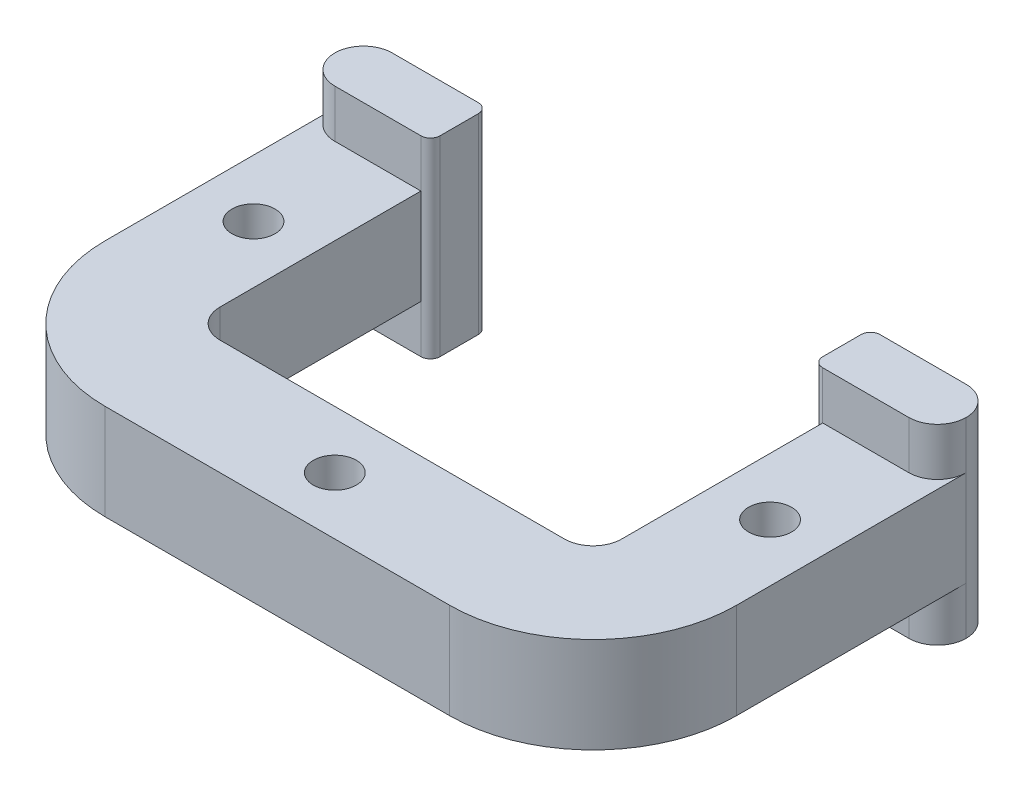
from build123d import *

# Parameters (mm, degrees)
BOSS_EXTRUDE1_DEPTH = 20
SKETCH2_R           = 2.75
CUT_EXTRUDE1_DEPTH  = 5
FILLET1_R           = 1
SKETCH7_W           = 42
SKETCH7_H           = 12
CUT_EXTRUDE3_DEPTH  = 5
SKETCH9_R           = 2.25
CUT_EXTRUDE5_DEPTH  = 56.479726027
FILLET3_R           = 15
FILLET4_R           = 3
FILLET5_R           = 3


# Some blends are built 0.0001 mm under size
with BuildPart() as part:
    # Sketch1 → Boss-Extrude1 (new body)
    with BuildSketch(Plane(origin=(0, 0, 0), x_dir=(1, 0, 0), z_dir=(0, 1, 0))):
        Polygon((21, -30), (-21, -30), (-21, -6), (-20, -6), (-20, 0), (-33, 0), (-33, -42), (33, -42), (33, 0), (20, 0), (20, -6), (21, -6), align=None)
    extrude(amount=BOSS_EXTRUDE1_DEPTH)

    # Sketch2 → Cut-Extrude1 (cut)
    with BuildSketch(Plane(origin=(0, 0, 0), x_dir=(-1, 0, 0), z_dir=(0, 0, -1))):
        with Locations((-24.25, 14.79)):
            Circle(SKETCH2_R)
        with Locations((-24.25, 4.79)):
            Circle(SKETCH2_R)
    cut_extrude1 = extrude(amount=-CUT_EXTRUDE1_DEPTH, mode=Mode.SUBTRACT)

    # Mirror1: Cut-Extrude1 across plane
    add(cut_extrude1.mirror(Plane(origin=(0, 0, 0), x_dir=(0, 0, 1), z_dir=(1, 0, 0))), mode=Mode.SUBTRACT)

    # Fillet1
    fillet1_edges = [part.edges().sort_by_distance(p)[0] for p in [
        (-20, 10, 0),
        (20, 10, 0),
        (20, 10, 6),
        (-20, 10, 6),
    ]]
    fillet(fillet1_edges, radius=FILLET1_R - 0.0001)  # a hair under: the kernel refuses the full size

    # Sketch7 → Cut-Extrude3 (cut)
    with BuildSketch(Plane.XZ):
        Polygon((-33, 6), (-21, 6), (-21, 30), (-21, 42), (-33, 42), align=None)
        with Locations((0, 36)):
            Rectangle(SKETCH7_W, SKETCH7_H)
        Polygon((21, 42), (21, 30), (21, 6), (33, 6), (33, 42), align=None)
    cut_extrude3 = extrude(amount=-CUT_EXTRUDE3_DEPTH, mode=Mode.SUBTRACT)

    # Mirror2: Cut-Extrude3 across plane
    add(cut_extrude3.mirror(Plane.ZX.offset(10)), mode=Mode.SUBTRACT)

    # Sketch9 → Cut-Extrude5 (cut, through all)
    with BuildSketch(Plane.XZ.offset(-5)):
        with Locations(Location((-27, 17.5, 0), (0, 0, 270))):
            Circle(SKETCH9_R)
        with Locations(Location((27, 17.5, 0), (0, 0, 270))):
            Circle(SKETCH9_R)
        with Locations(Location((0, 36, 0), (0, 0, 270))):
            Circle(SKETCH9_R)
    extrude(amount=-CUT_EXTRUDE5_DEPTH, mode=Mode.SUBTRACT)

    # Fillet3
    fillet3_edges = [part.edges().sort_by_distance(p)[0] for p in [
        (-33, 10, 42),
        (33, 10, 42),
    ]]
    fillet(fillet3_edges, radius=FILLET3_R)

    # Fillet4
    fillet4_edges = [part.edges().sort_by_distance(p)[0] for p in [
        (-21, 10, 30),
        (21, 10, 30),
    ]]
    fillet(fillet4_edges, radius=FILLET4_R)

    # Fillet5
    # the kernel refuses this fillet: 3 mm, written as the material it takes off along each edge
    with BuildSketch(Plane(origin=(-33, 27.5, 6), x_dir=(1, 0, 0), z_dir=(0, -1, 0)), Plane(origin=(33, -7.5, 6), x_dir=(-1, 0, 0), z_dir=(0, 1, 0))) as fillet5_piece_1:
        with BuildLine():
            CenterArc((FILLET5_R, -FILLET5_R), FILLET5_R, 90, 90)
            Line((0, -FILLET5_R), (0, 0))
            Line((0, 0), (FILLET5_R, 0))
        make_face()
    extrude(amount=12.5, mode=Mode.SUBTRACT)
    with BuildSketch(Plane(origin=(33, 27.5, 6), x_dir=(-1, 0, 0), z_dir=(0, -1, 0)), Plane(origin=(-33, -7.5, 6), x_dir=(1, 0, 0), z_dir=(0, 1, 0))) as fillet5_piece_2:
        with BuildLine():
            CenterArc((FILLET5_R, FILLET5_R), FILLET5_R, 180, 90)
            Line((0, FILLET5_R), (0, 0))
            Line((0, 0), (FILLET5_R, 0))
        make_face()
    extrude(amount=12.5, mode=Mode.SUBTRACT)
    with BuildSketch(Plane(origin=(-33, -7.5, 0), x_dir=(0, 0, 1), z_dir=(0, 1, 0))) as fillet5_piece_3:
        with BuildLine():
            CenterArc((FILLET5_R, FILLET5_R), FILLET5_R, 180, 90)
            Line((0, FILLET5_R), (0, 0))
            Line((0, 0), (FILLET5_R, 0))
        make_face()
    extrude(amount=35, mode=Mode.SUBTRACT)
    with BuildSketch(Plane(origin=(33, -7.5, 0), x_dir=(0, 0, 1), z_dir=(0, 1, 0))) as fillet5_piece_4:
        with BuildLine():
            CenterArc((FILLET5_R, -FILLET5_R), FILLET5_R, 90, 90)
            Line((0, -FILLET5_R), (0, 0))
            Line((0, 0), (FILLET5_R, 0))
        make_face()
    extrude(amount=35, mode=Mode.SUBTRACT)


solid = part.part
